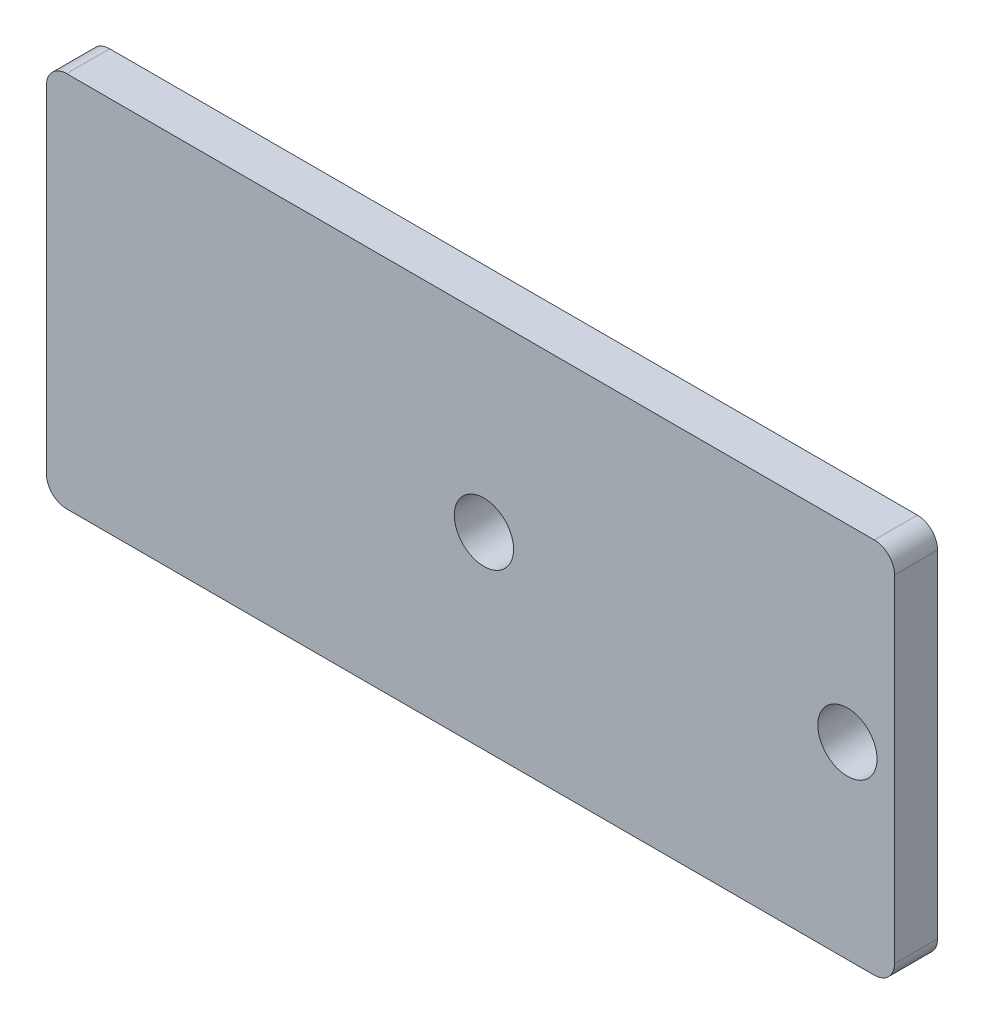
from build123d import *

# Parameters (mm, degrees)
MODEL_R             = 1.1
BOSS_EXTRUDE1_DEPTH = 0.8


with BuildPart() as part:
    # Model → Boss-Extrude1 (new, symmetric)
    with BuildSketch(Plane.XY):
        with BuildLine():
            Line((-15, -7), (15, -7))
            ThreePointArc((15, -7), (15.530330086, -6.780330086), (15.75, -6.25))
            Line((15.75, -6.25), (15.75, 6.25))
            ThreePointArc((15.75, 6.25), (15.530330086, 6.780330086), (15, 7))
            Line((15, 7), (-15, 7))
            ThreePointArc((-15, 7), (-15.530330086, 6.780330086), (-15.75, 6.25))
            Line((-15.75, 6.25), (-15.75, -6.25))
            ThreePointArc((-15.75, -6.25), (-15.530330086, -6.780330086), (-15, -7))
        make_face()
        with Locations((0.5, 0)):
            Circle(MODEL_R, mode=Mode.SUBTRACT)
        with Locations((14, 0)):
            Circle(MODEL_R, mode=Mode.SUBTRACT)
    extrude(amount=BOSS_EXTRUDE1_DEPTH, both=True)


solid = part.part
